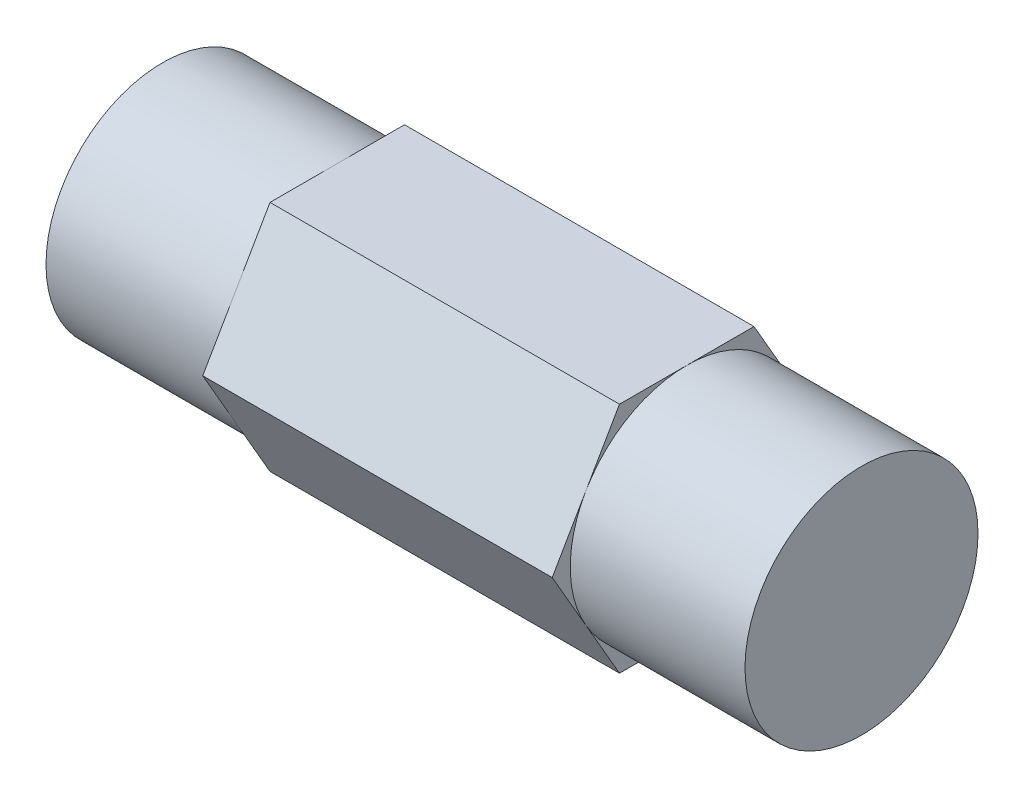
from build123d import *

# Parameters (mm, degrees)
BOSS_EXTRUDE1_DEPTH = 19.05
SKETCH2_R           = 6.35
BOSS_EXTRUDE2_DEPTH = 9.525
BOSS_EXTRUDE3_START = 9.525
SKETCH3_R           = 6.35
BOSS_EXTRUDE3_DEPTH = 9.525


with BuildPart() as part:
    # Sketch1 → Boss-Extrude1 (new body)
    with BuildSketch(Plane(origin=(0, 0, 0), x_dir=(0, 0, -1), z_dir=(1, 0, 0))):
        Polygon((-3.666174209, -6.35), (3.666174209, -6.35), (7.332348419, 0), (3.666174209, 6.35), (-3.666174209, 6.35), (-7.332348419, 0), align=None)
    extrude(amount=BOSS_EXTRUDE1_DEPTH)

    # Sketch2 → Boss-Extrude2 (add)
    with BuildSketch(Plane(origin=(19.05, 0, 0), x_dir=(0, 0, -1), z_dir=(1, 0, 0))):
        Circle(SKETCH2_R)
    extrude(amount=BOSS_EXTRUDE2_DEPTH)

    # Sketch3 → Boss-Extrude3 (add)
    with BuildSketch(Plane.ZY.offset(BOSS_EXTRUDE3_START)):
        Circle(SKETCH3_R)
    extrude(amount=-BOSS_EXTRUDE3_DEPTH)


solid = part.part
